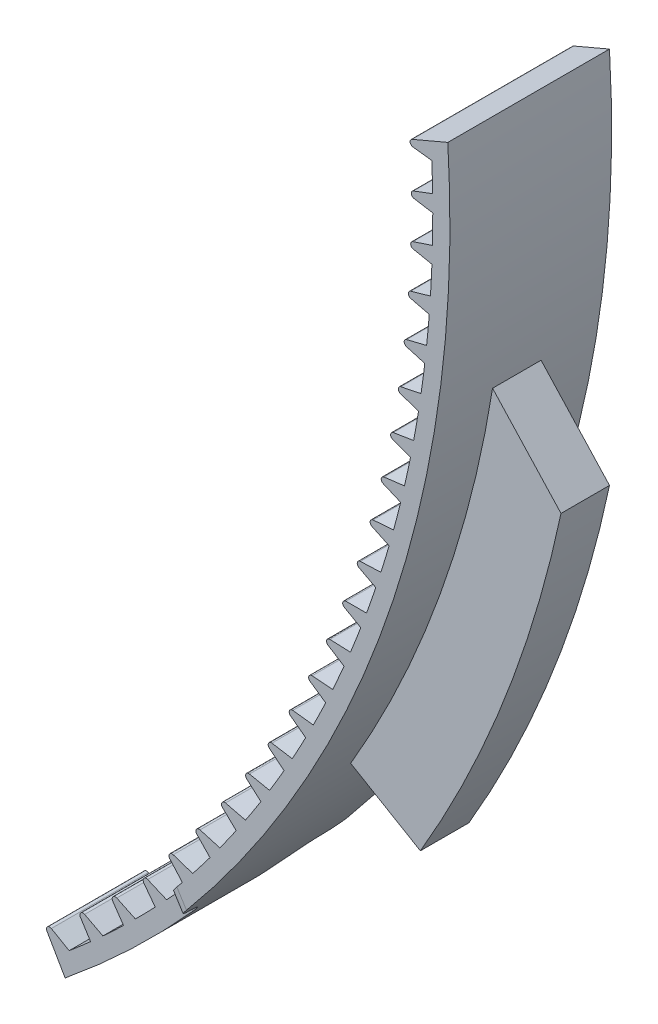
from build123d import *

# Parameters (mm, degrees)
BOSS_EXTRU_1_DEPTH      = 10
CONG_1_R                = 0.2
CONG_2_R                = 0.2
BOSS_EXTRU_2_START      = -3.5
BOSS_EXTRU_2_DEPTH      = 3
ENL_V_MAT_EXTRU_1_DEPTH = 59.085952979


with BuildPart() as part:
    # Esquisse1 → Boss.-Extru.1 (new body)
    with BuildSketch(Plane.XY):
        with BuildLine():
            Line((-32.07152697, 2.598076211), (-30.57152697, 0))
            ThreePointArc((-30.57152697, 0), (-10.648982753, 26.19601646), (-4.89949069, 58.600991194))
            Line((-4.899490693, 58.600991193), (-7.797282878, 57.366357326))
            Line((-7.797282878, 57.366357326), (-5.889825448, 57.134750062))
            ThreePointArc((-5.889825448, 57.134750062), (-5.859166079, 56.2591659), (-5.839637024, 55.383262801))
            Line((-5.839637024, 55.383262801), (-7.727507012, 54.667288155))
            Line((-7.727507012, 54.667288155), (-5.830922418, 54.359063158))
            ThreePointArc((-5.830922418, 54.359063158), (-5.835544133, 53.482954568), (-5.851299978, 52.606975473))
            Line((-5.851299978, 52.606975473), (-7.766468292, 51.967598343))
            Line((-7.766468292, 51.967598343), (-5.883832801, 51.583255555))
            ThreePointArc((-5.883832801, 51.583255555), (-5.923728104, 50.708043589), (-5.974743292, 49.833409338))
            Line((-5.974743292, 49.833409338), (-7.914103523, 49.271666797))
            Line((-7.914103523, 49.271666797), (-6.048470776, 48.811829624))
            ThreePointArc((-6.048470776, 48.811829624), (-6.123574957, 47.938933878), (-6.209766742, 47.067063132))
            Line((-6.209766742, 47.067063132), (-8.170173239, 46.583866328))
            Line((-8.170173239, 46.583866328), (-6.3245693, 46.049280628))
            ThreePointArc((-6.3245693, 46.049280628), (-6.434760539, 45.180116942), (-6.555989118, 44.312423878))
            Line((-6.555989118, 44.312423878), (-8.534262096, 43.908556558))
            Line((-8.534262096, 43.908556558), (-6.71168054, 43.30008943))
            ThreePointArc((-6.71168054, 43.30008943), (-6.856780107, 42.436067591), (-7.012848846, 41.57395961))
            Line((-7.012848846, 41.57395961), (-9.005779538, 41.250076849))
            Line((-9.005779538, 41.250076849), (-7.209176601, 40.568715229))
            ThreePointArc((-7.209176601, 40.568715229), (-7.388949143, 39.711236684), (-7.579604898, 38.856112129))
            Line((-7.579604898, 38.856112129), (-9.583960764, 38.612739265))
            Line((-9.583960764, 38.612739265), (-7.816250541, 37.859588324))
            ThreePointArc((-7.816250541, 37.859588324), (-8.030404467, 37.010043906), (-8.255337994, 36.163289792))
            Line((-8.255337994, 36.163289792), (-10.267867961, 36.000821577))
            Line((-10.267867961, 36.000821577), (-8.531917684, 35.177102929))
            ThreePointArc((-8.531917684, 35.177102929), (-8.780105636, 34.336870603), (-9.038952092, 33.499860368))
            Line((-9.038952092, 33.499860368), (-11.056391829, 33.418560326))
            Line((-11.056391829, 33.418560326), (-9.355017217, 32.525610045))
            ThreePointArc((-9.355017217, 32.525610045), (-9.636836632, 31.69605267), (-9.929176168, 30.870143948))
            Line((-9.929176168, 30.870143948), (-11.94825338, 30.870143948))
            Line((-11.94825338, 30.870143948), (-10.284214068, 29.909410403))
            ThreePointArc((-10.284214068, 29.909410403), (-10.599207835, 29.091873524), (-10.924566274, 28.278405942))
            Line((-10.924566274, 28.278405942), (-12.94200601, 28.359705984))
            Line((-12.94200601, 28.359705984), (-11.318001077, 27.332747489))
            ThreePointArc((-11.318001077, 27.332747489), (-11.665658274, 26.528557154), (-12.023507884, 25.728850158))
            Line((-12.023507884, 25.728850158), (-14.03603785, 25.891318373))
            Line((-14.03603785, 25.891318373), (-12.454701437, 24.799800658))
            ThreePointArc((-12.454701437, 24.799800658), (-12.834458164, 24.010261267), (-13.22421851, 23.225611986))
            Line((-13.22421851, 23.225611986), (-15.228574376, 23.468984851))
            Line((-15.228574376, 23.468984851), (-13.692471417, 22.314678361))
            ThreePointArc((-13.692471417, 22.314678361), (-14.103711706, 21.541070549), (-14.524750597, 20.772751687))
            Line((-14.524750597, 20.772751687), (-16.517681289, 21.096634449))
            Line((-16.517681289, 21.096634449), (-15.029303348, 19.881411474))
            ThreePointArc((-15.029303348, 19.881411474), (-15.471360166, 19.124990037), (-15.922994676, 18.37424781))
            Line((-15.922994676, 18.37424781), (-17.901267654, 18.77811513))
            Line((-17.901267654, 18.77811513), (-16.463028885, 17.503946766))
            ThreePointArc((-16.463028885, 17.503946766), (-16.935185215, 16.765938621), (-17.416682789, 16.033990735))
            Line((-17.416682789, 16.033990735), (-19.377089287, 16.517187539))
            Line((-19.377089287, 16.517187539), (-17.99132252, 15.186140493))
            ThreePointArc((-17.99132252, 15.186140493), (-18.492812521, 14.467742692), (-19.00339217, 13.75577637))
            Line((-19.00339217, 13.75577637), (-20.942752401, 14.317518911))
            Line((-20.942752401, 14.317518911), (-19.611705354, 12.931752144))
            ThreePointArc((-19.611705354, 12.931752144), (-20.141715609, 12.234129932), (-20.68054917, 11.543299985))
            Line((-20.68054917, 11.543299985), (-22.595717485, 12.182677115))
            Line((-22.595717485, 12.182677115), (-21.321549121, 10.744438347))
            ThreePointArc((-21.321549121, 10.744438347), (-21.879219951, 10.068723269), (-22.445433434, 9.400150226))
            Line((-22.445433434, 9.400150226), (-24.333303423, 10.116124873))
            Line((-24.333303423, 10.116124873), (-23.118080448, 8.627746932))
            ThreePointArc((-23.118080448, 8.627746932), (-23.702507309, 7.975035), (-24.295182314, 7.32980329))
            Line((-24.295182314, 7.32980329), (-26.152691844, 8.12121414))
            Line((-26.152691844, 8.12121414), (-24.998385355, 6.585111181))
            ThreePointArc((-24.998385355, 6.585111181), (-25.608620304, 5.956461096), (-26.22679551, 5.335617286))
            Line((-26.22679551, 5.335617286), (-28.050931694, 6.201180668))
            Line((-28.050931694, 6.201180668), (-26.959413979, 4.619844255))
            ThreePointArc((-26.959413979, 4.619844255), (-27.594467213, 4.016275691), (-28.237139938, 3.420826792))
            Line((-28.237139938, 3.420826792), (-30.024944021, 4.359138759))
            Line((-30.024944021, 4.359138759), (-28.997985526, 2.735133826))
            ThreePointArc((-28.997985526, 2.735133826), (-29.656826987, 2.157625772), (-30.322954812, 1.588537606))
            Line((-30.322954812, 1.588537606), (-32.07152697, 2.598076211))
        make_face()
    extrude(amount=-BOSS_EXTRU_1_DEPTH)

    # Congé1
    cong_1_edges = [part.edges().sort_by_distance(p)[0] for p in [
        (-32.07152697, 2.598076211, -5),
    ]]
    fillet(cong_1_edges, radius=CONG_1_R)

    # Congé2
    # the kernel refuses this fillet: 0.2 mm, written as the material it takes off along each edge
    with BuildSketch(Plane(origin=(-8.170173239, 46.583866328, 1.866025404), x_dir=(0.970941817437755, 0.23931566424007694, 0), z_dir=(0, 0, -1)), Plane(origin=(-7.914103523, 49.271666797, 1.866025404), x_dir=(0.960518111645693, 0.2782174638670119, 0), z_dir=(0, 0, -1)), Plane(origin=(-7.766468292, 51.967598343, 1.866025404), x_dir=(0.9485364419642636, 0.31666799375019766, 0), z_dir=(0, 0, -1)), Plane(origin=(-7.727507012, 54.667288155, 1.866025404), x_dir=(0.9350162427054973, 0.3546048869895825, 0), z_dir=(0, 0, -1)), Plane(origin=(-7.797282878, 57.366357326, 1.866025404), x_dir=(0.919979443682031, 0.3919666098056068, 0), z_dir=(0, 0, -1)), Plane(origin=(-11.94825338, 30.870143948, 1.866025404), x_dir=(1.0, -3.346568838905764e-11, 0), z_dir=(0, 0, -1)), Plane(origin=(-11.056391829, 33.418560326, 1.866025404), x_dir=(0.9991889981730206, 0.04026594007340961, 0), z_dir=(0, 0, -1)), Plane(origin=(-10.267867961, 36.000821577, 1.866025404), x_dir=(0.9967573081373173, 0.08046656867823304, 0), z_dir=(0, 0, -1)), Plane(origin=(-9.583960764, 38.612739265, 1.866025404), x_dir=(0.9927088741030192, 0.12053668021443095, 0), z_dir=(0, 0, -1)), Plane(origin=(-9.005779538, 41.250076849, 1.866025404), x_dir=(0.9870502626449316, 0.16041128081457198, 0), z_dir=(0, 0, -1)), Plane(origin=(-8.534262096, 43.908556558, 1.866025404), x_dir=(0.9797906520515351, 0.20002569373064996, 0), z_dir=(0, 0, -1))) as cong_2_piece_1:
        with BuildLine():
            CenterArc((CONG_2_R * 3.73205080757, CONG_2_R), CONG_2_R, 120, 150)
            Line((CONG_2_R * 3.23205080757, CONG_2_R * 1.86602540378), (0, 0))
            Line((0, 0), (CONG_2_R * 3.73205080757, 0))
        make_face()
    extrude(amount=13.732050808, mode=Mode.SUBTRACT)
    with BuildSketch(Plane(origin=(-30.024944021, 4.359138759, 1.866025404), x_dir=(0.5344658261256245, -0.8451900855451712, 0), z_dir=(0, 0, -1)), Plane(origin=(-28.050931694, 6.201180668, 1.866025404), x_dir=(0.5680647467269166, -0.8229838658965823, 0), z_dir=(0, 0, -1)), Plane(origin=(-26.152691844, 8.12121414, 1.866025404), x_dir=(0.6007422642318037, -0.7994427634081415, 0), z_dir=(0, 0, -1)), Plane(origin=(-24.333303423, 10.116124873, 1.866025404), x_dir=(0.6324453755874017, -0.7746049618341664, 0), z_dir=(0, 0, -1)), Plane(origin=(-22.595717485, 12.182677115, 1.866025404), x_dir=(0.6631226582311635, -0.748510748179634, 0), z_dir=(0, 0, -1)), Plane(origin=(-20.942752401, 14.317518911, 1.866025404), x_dir=(0.6927243534984586, -0.7212024473545154, 0), z_dir=(0, 0, -1)), Plane(origin=(-19.377089287, 16.517187539, 1.866025404), x_dir=(0.721202447331331, -0.6927243535225961, 0), z_dir=(0, 0, -1)), Plane(origin=(-17.901267654, 18.77811513, 1.866025404), x_dir=(0.7485107481574478, -0.6631226582562066, 0), z_dir=(0, 0, -1)), Plane(origin=(-16.517681289, 21.096634449, 1.866025404), x_dir=(0.7746049618130029, -0.6324453756133225, 0), z_dir=(0, 0, -1)), Plane(origin=(-15.228574376, 23.468984851, 1.866025404), x_dir=(0.7994427633880382, -0.6007422642585565, 0), z_dir=(0, 0, -1)), Plane(origin=(-14.03603785, 25.891318373, 1.866025404), x_dir=(0.8229838658775736, -0.5680647467544558, 0), z_dir=(0, 0, -1)), Plane(origin=(-12.94200601, 28.359705984, 1.866025404), x_dir=(0.8451900855272863, -0.5344658261539073, 0), z_dir=(0, 0, -1))) as cong_2_piece_2:
        with BuildLine():
            CenterArc((CONG_2_R * 3.73205080757, -CONG_2_R), CONG_2_R, 90, 150)
            Line((CONG_2_R * 3.23205080757, -CONG_2_R * 1.86602540378), (0, 0))
            Line((0, 0), (CONG_2_R * 3.73205080757, 0))
        make_face()
    extrude(amount=13.732050808, mode=Mode.SUBTRACT)

    # Esquisse2 → Boss.-Extru.2 (add)
    with BuildSketch(Plane.XY.offset(BOSS_EXTRU_2_START)):
        with BuildLine():
            Line((-14.407997696, 18.832189558), (-10.096691331, 16.299870968))
            ThreePointArc((-10.096691331, 16.299870968), (-4.842568047, 27.161346957), (-1.398101336, 38.724785944))
            Line((-1.398101336, 38.724785944), (-5.631225089, 43.314542986))
            ThreePointArc((-5.631225089, 43.314542986), (-8.872596786, 30.662168615), (-14.407997696, 18.832189558))
        make_face()
    extrude(amount=-BOSS_EXTRU_2_DEPTH)

    # Esquisse3 → Enlèv. mat.-Extru.1 (cut, through all)
    with BuildSketch(Plane(origin=(-15.327097497, 28.52684621, 36.910859079), x_dir=(-0.8466464939608794, -0.5321557236972562, 0), z_dir=(-0.5321557236972562, 0.8466464939608794, 0))):
        with BuildLine():
            Line((26.916763691, -38.910859079), (17.3862867, -38.910859079))
            ThreePointArc((17.3862867, -38.910859079), (16.508602545, -38.587152283), (16.051292999, -37.771074133))
            ThreePointArc((16.051292999, -37.771074133), (15.706985676, -37.155876294), (15.045939174, -36.910859079))
            Line((15.045939174, -36.910859079), (28.087367255, -36.910859079))
            Line((28.087367255, -36.910859079), (28.087367255, -38.910859079))
            Line((28.087367255, -38.910859079), (26.916763691, -38.910859079))
        make_face()
        with BuildLine():
            Line((26.916763691, -44.910859079), (17.3862867, -44.910859079))
            ThreePointArc((17.3862867, -44.910859079), (16.508602545, -45.234565876), (16.051292999, -46.050644026))
            ThreePointArc((16.051292999, -46.050644026), (15.706985676, -46.665841864), (15.045939174, -46.910859079))
            Line((15.045939174, -46.910859079), (28.087367255, -46.910859079))
            Line((28.087367255, -46.910859079), (28.087367255, -44.910859079))
            Line((28.087367255, -44.910859079), (26.916763691, -44.910859079))
        make_face()
    extrude(amount=-ENL_V_MAT_EXTRU_1_DEPTH, mode=Mode.SUBTRACT)


solid = part.part
